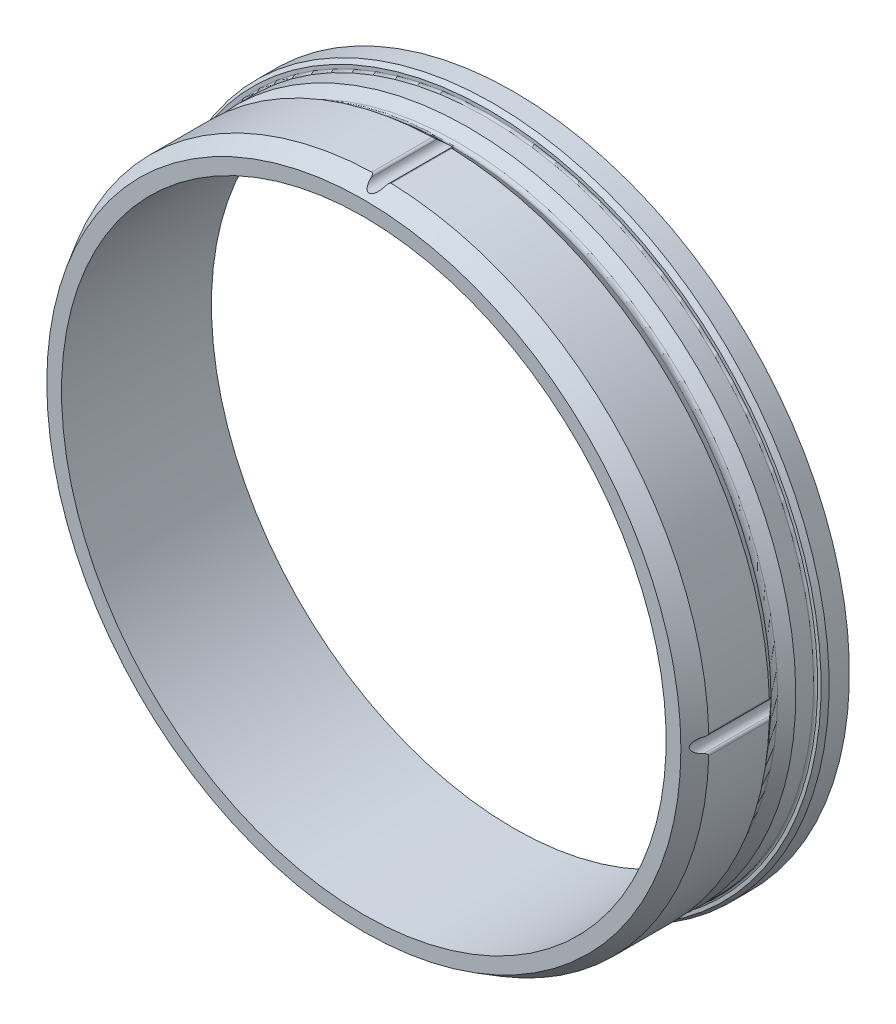
from build123d import *

# Parameters (mm, degrees)
CUT_EXTRUDE1_REACH       = 99.99
FILLET2_R                = 0.5
CIRPATTERN1_COUNT        = 4
FILLET2_OF_CIRPATTERN1_R = 0.5


with BuildPart() as part:
    # Sketch1 → Revolve1 (revolve)
    with BuildSketch(Plane(origin=(0, 0, 0), x_dir=(0, 0, -1), z_dir=(1, 0, 0))):
        with BuildLine():
            Line((0, 66.075), (-4, 66.075))
            Line((-4, 66.075), (-5, 65.497649731))
            Line((-5, 65.497649731), (-5, 64.825))
            ThreePointArc((-5, 64.825), (-5.117157288, 64.542157288), (-5.4, 64.425))
            Line((-5.4, 64.425), (-8.907935936, 64.425))
            Line((-8.907935936, 64.425), (-10.85721239, 62.789362846))
            ThreePointArc((-10.85721239, 62.789362846), (-11.5, 62.555407289), (-12.14278761, 62.789362846))
            Line((-12.14278761, 62.789362846), (-14.092064064, 64.425))
            Line((-14.092064064, 64.425), (-26, 64.425))
            Line((-26, 64.425), (-29.5, 62.404274058))
            Line((-29.5, 62.404274058), (-29.5, 59.5))
            Line((-29.5, 59.5), (0, 59.5))
            Line((0, 59.5), (0, 66.075))
        make_face()
    revolve(axis=Axis((0, 0, 0), (0, 0, 1)))

    # Cut-Extrude1: up to this cone (the profile starts inside it)
    cut_extrude1_end = Plane(origin=(0, 0, 29.5), z_dir=(0, 0, 1)).offset(-92.186660139) * Cone(1e-06, 226.582454778, 270.0304535, align=(Align.CENTER, Align.CENTER, Align.MIN), mode=Mode.PRIVATE)
    # Sketch2 → Cut-Extrude1 (cut, up to the surface)
    with BuildSketch(Plane.XY.offset(29.5), mode=Mode.PRIVATE) as cut_extrude1_sk1:
        with BuildLine():
            Line((-1.5, 71.606143653), (1.5, 71.606143653))
            Line((1.5, 71.606143653), (1.5, 64.5))
            ThreePointArc((1.5, 64.5), (0, 63), (-1.5, 64.5))
            Line((-1.5, 64.5), (-1.5, 71.606143653))
        make_face()
    cut_extrude1_tool1 = extrude(cut_extrude1_sk1.sketch, amount=-CUT_EXTRUDE1_REACH, mode=Mode.PRIVATE) & cut_extrude1_end
    cut_extrude1 = cut_extrude1_tool1.solids().sort_by_distance((0, 67.457258, 29.5))[0]
    add(cut_extrude1, mode=Mode.SUBTRACT)

    # Fillet2
    fillet2_edges = [part.edges().sort_by_distance(p)[0] for p in [
        (1.497151483, 64.407601744, 20.046032018),
        (-1.497151483, 64.407601744, 20.046032018),
    ]]
    fillet(fillet2_edges, radius=FILLET2_R)

    # CirPattern1: Cut-Extrude1 ×4 about axis
    cirpattern1_axis = Axis((0, 0, 0), (0, 0, -1))
    for i in range(1, CIRPATTERN1_COUNT):
        add(cut_extrude1.rotate(cirpattern1_axis, i * 360 / CIRPATTERN1_COUNT), mode=Mode.SUBTRACT)

    # Fillet2 of CirPattern1
    fillet2_of_cirpattern1_edges = [part.edges().sort_by_distance(p)[0] for p in [
        (64.407601744, -1.497151483, 20.046032018),
        (64.407601744, 1.497151483, 20.046032018),
        (-1.497151483, -64.407601744, 20.046032018),
        (1.497151483, -64.407601744, 20.046032018),
        (-64.407601744, 1.497151483, 20.046032018),
        (-64.407601744, -1.497151483, 20.046032018),
    ]]
    fillet(fillet2_of_cirpattern1_edges, radius=FILLET2_OF_CIRPATTERN1_R)


solid = part.part
